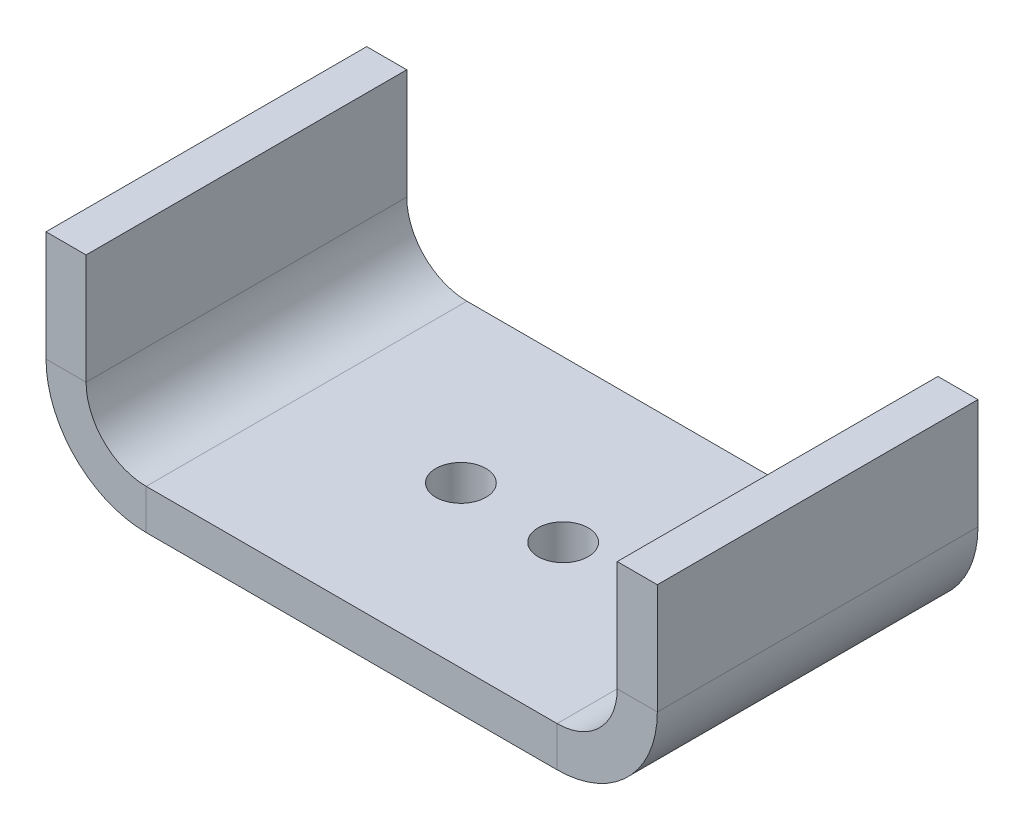
from build123d import *

# Parameters (mm, degrees)
BASE_FLANGE1_DEPTH = 16
SKETCH8_R          = 1.25
CUT_EXTRUDE1_DEPTH = 2


# Sheet-metal steps are written as plain solids
with BuildPart() as part:
    # Sketch1 → Base-Flange1 (new body)
    with BuildSketch(Plane.XY):
        with BuildLine():
            Line((-13.822681927, 15.418198529), (-13.822681927, 9.918198529))
            ThreePointArc((-13.822681927, 9.918198529), (-12.358215833, 6.382664623), (-8.822681927, 4.918198529))
            Line((-8.822681927, 4.918198529), (11.677318073, 4.918198529))
            ThreePointArc((11.677318073, 4.918198529), (15.212851979, 6.382664623), (16.677318073, 9.918198529))
            Line((16.677318073, 9.918198529), (16.677318073, 15.418198529))
            Line((16.677318073, 15.418198529), (14.677318073, 15.418198529))
            Line((14.677318073, 15.418198529), (14.677318073, 9.918198529))
            ThreePointArc((14.677318073, 9.918198529), (13.798638417, 7.796878186), (11.677318073, 6.918198529))
            Line((11.677318073, 6.918198529), (-8.822681927, 6.918198529))
            ThreePointArc((-8.822681927, 6.918198529), (-10.94400227, 7.796878186), (-11.822681927, 9.918198529))
            Line((-11.822681927, 9.918198529), (-11.822681927, 15.418198529))
            Line((-11.822681927, 15.418198529), (-13.822681927, 15.418198529))
        make_face()
    extrude(amount=BASE_FLANGE1_DEPTH)

    # Sketch8 → Cut-Extrude1 (cut)
    with BuildSketch(Plane(origin=(0, 6.918198529, 0), x_dir=(1, 0, 0), z_dir=(0, 1, 0))):
        with Locations(Location((3.992812071, -8.013954427, 0), (0, 0, 270))):
            Circle(SKETCH8_R)
        with Locations(Location((-1.122681927, -8, 0), (0, 0, 270))):
            Circle(SKETCH8_R)
    extrude(amount=-CUT_EXTRUDE1_DEPTH, mode=Mode.SUBTRACT)


solid = part.part
